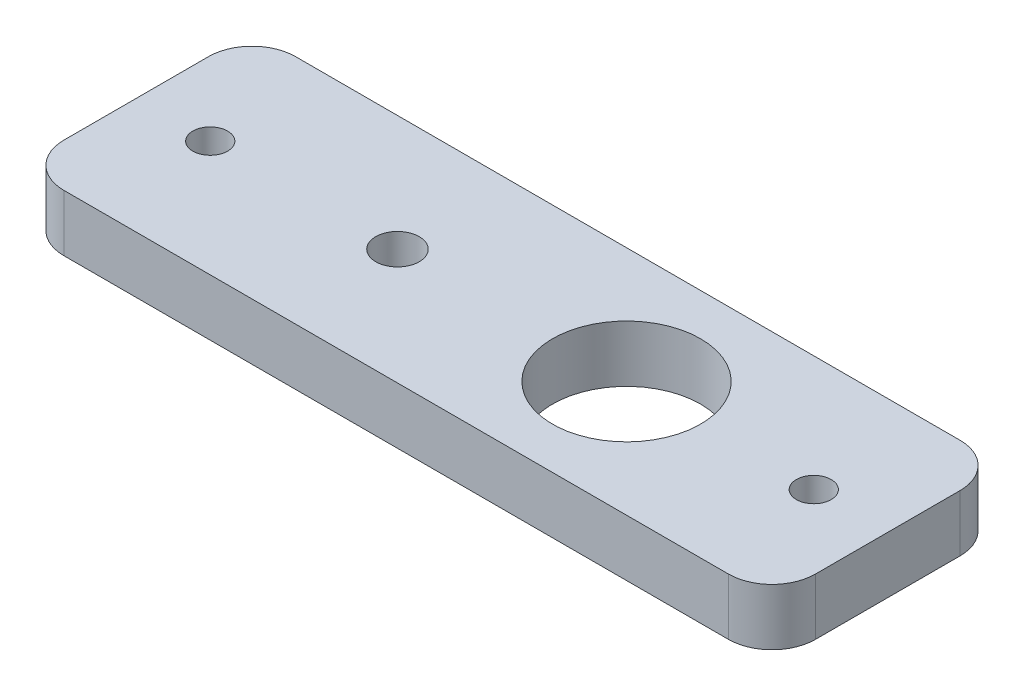
from build123d import *

# Parameters (mm, degrees)
SKETCH1_W           = 86.3
SKETCH1_H           = 26.6
SKETCH1_R           = 2.5
SKETCH1_R_2         = 2
SKETCH1_R_3         = 8.5
BOSS_EXTRUDE1_DEPTH = 6.5
FILLET1_R           = 5


with BuildPart() as part:
    # Sketch1 → Boss-Extrude1 (new body)
    with BuildSketch(Plane(origin=(0, 0, 0), x_dir=(1, 0, 0), z_dir=(0, 1, 0))):
        with Locations((-13.15, 0)):
            Rectangle(SKETCH1_W, SKETCH1_H)
        with Locations((-26.3, 0)):
            Circle(SKETCH1_R, mode=Mode.SUBTRACT)
        with Locations((-47.8, 0)):
            Circle(SKETCH1_R_2, mode=Mode.SUBTRACT)
        with Locations((21.5, 0)):
            Circle(SKETCH1_R_2, mode=Mode.SUBTRACT)
        Circle(SKETCH1_R_3, mode=Mode.SUBTRACT)
    extrude(amount=BOSS_EXTRUDE1_DEPTH)

    # Fillet1
    fillet1_edges = [part.edges().sort_by_distance(p)[0] for p in [
        (-56.3, 3.25, -13.3),
        (30, 3.25, -13.3),
        (30, 3.25, 13.3),
        (-56.3, 3.25, 13.3),
    ]]
    fillet(fillet1_edges, radius=FILLET1_R)


solid = part.part
